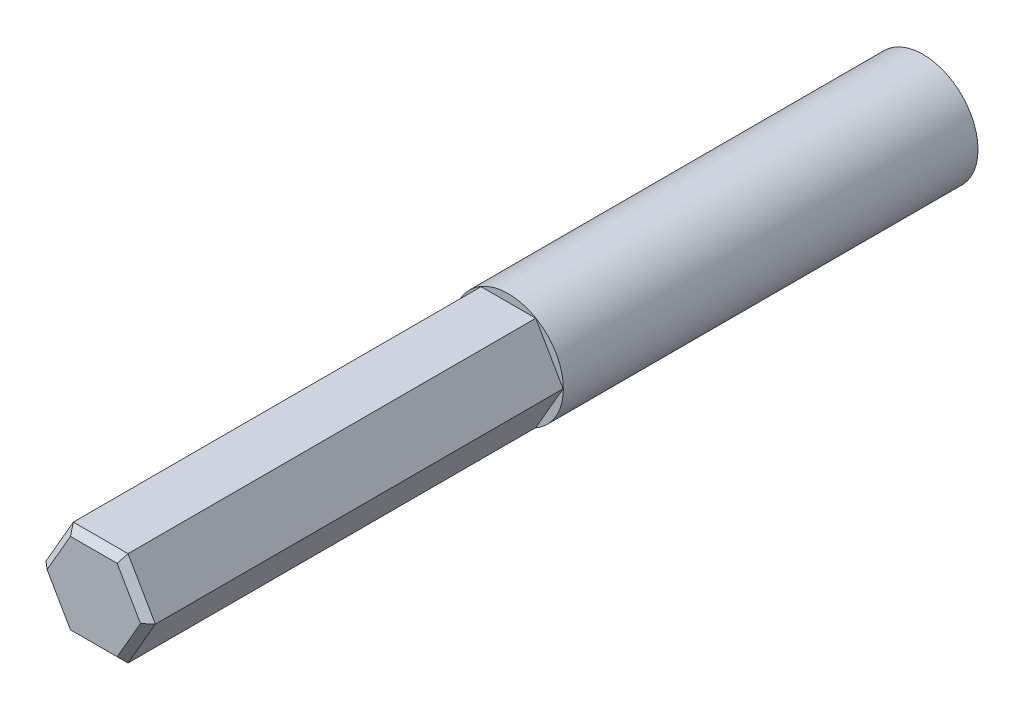
from build123d import *

# Parameters (mm, degrees)
SKETCH1_R           = 3.975
BOSS_EXTRUDE1_DEPTH = 30
BOSS_EXTRUDE2_DEPTH = 30
CHAMFER2_SIZE       = 0.5


with BuildPart() as part:
    # Sketch1 → Boss-Extrude1 (new body)
    with BuildSketch(Plane.XY):
        Circle(SKETCH1_R)
    extrude(amount=BOSS_EXTRUDE1_DEPTH)

    # Sketch2 → Boss-Extrude2 (add)
    with BuildSketch(Plane.XY.offset(30)):
        Polygon((3.95669873, 0), (1.978349365, 3.426601615), (-1.978349365, 3.426601615), (-3.95669873, 0), (-1.978349365, -3.426601615), (1.978349365, -3.426601615), align=None)
    extrude(amount=BOSS_EXTRUDE2_DEPTH)

    # Chamfer2
    chamfer2_edges = [part.edges().sort_by_distance(p)[0] for p in [
        (0, -3.426601615, 60),
        (-2.967524047, -1.713300808, 60),
        (-2.967524047, 1.713300808, 60),
        (0, 3.426601615, 60),
        (2.967524047, 1.713300808, 60),
        (2.967524047, -1.713300808, 60),
    ]]
    chamfer(chamfer2_edges, length=CHAMFER2_SIZE)


solid = part.part
